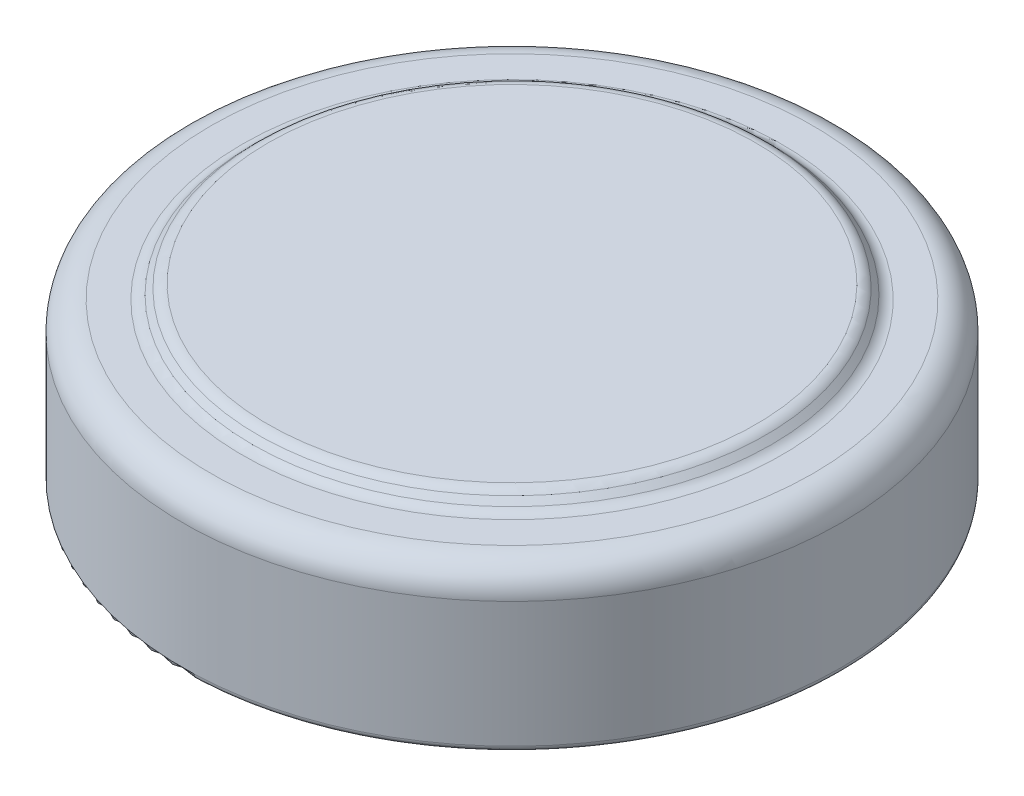
from build123d import *


with BuildPart() as part:
    # Sketch1 → Revolve1 (revolve)
    with BuildSketch(Plane.XY):
        with BuildLine():
            Line((0, 0), (-5.7, 0))
            ThreePointArc((-5.7, 0), (-5.770710678, 0.029289322), (-5.8, 0.1))
            Line((-5.8, 0.1), (-5.8, 2.306))
            ThreePointArc((-5.8, 2.306), (-5.653553391, 2.659553391), (-5.3, 2.806))
            Line((-5.3, 2.806), (-4.743553391, 2.806))
            ThreePointArc((-4.743553391, 2.806), (-4.647882533, 2.825030117), (-4.566776695, 2.879223305))
            Line((-4.566776695, 2.879223305), (-4.469223305, 2.976776695))
            ThreePointArc((-4.469223305, 2.976776695), (-4.388117467, 3.030969883), (-4.292446609, 3.05))
            Line((-4.292446609, 3.05), (0, 3.05))
            Line((0, 3.05), (0, 0))
        make_face()
    revolve(axis=Axis((0, 3.05, 0), (0, -1, 0)))


solid = part.part
